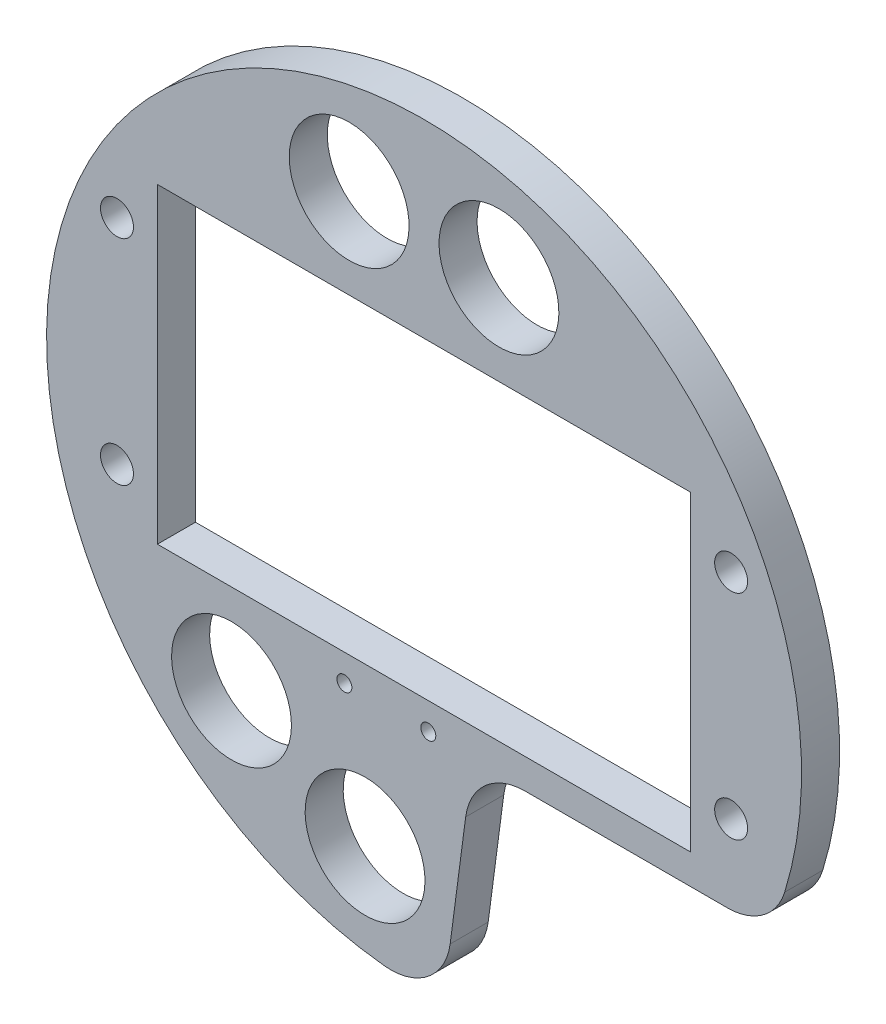
from build123d import *

# Parameters (mm, degrees)
SKETCH2_R           = 10
SKETCH2_R_2         = 2.75
SKETCH2_R_3         = 1.25
SKETCH2_W           = 89
SKETCH2_H           = 52
BOSS_EXTRUDE1_DEPTH = 6.35


with BuildPart() as part:
    # Sketch2 → Boss-Extrude1 (new body)
    with BuildSketch(Plane(origin=(0, 0, -110.625), x_dir=(-1, 0, 0), z_dir=(0, 0, -1))):
        with BuildLine():
            Line((-4.357448371, -54.013133709), (-6.946028661, -34.350914325))
            ThreePointArc((-6.946028661, -34.350914325), (-10.267019124, -28.137778173), (-16.860477275, -25.656176248))
            Line((-16.860477275, -25.656176248), (-50.634811595, -25.656176248))
            ThreePointArc((-50.634811595, -25.656176248), (-56.570299984, -23.704155969), (-60.188549632, -18.610171766))
            ThreePointArc((-60.188549632, -18.610171766), (34.680301225, 52.595405759), (6.605490855, -62.652753256))
            ThreePointArc((6.605490855, -62.652753256), (-0.632673359, -60.562038878), (-4.357448371, -54.013133709))
        make_face()
        with Locations((12.5, 46.343823752)):
            Circle(SKETCH2_R, mode=Mode.SUBTRACT)
        with Locations((-12.5, 46.343823752)):
            Circle(SKETCH2_R, mode=Mode.SUBTRACT)
        with Locations((32.134671235, -35.656176248)):
            Circle(SKETCH2_R, mode=Mode.SUBTRACT)
        with Locations((9.845967479, -46.979324435)):
            Circle(SKETCH2_R, mode=Mode.SUBTRACT)
        with Locations((51.25, 23.184046239)):
            Circle(SKETCH2_R_2, mode=Mode.SUBTRACT)
        with Locations((51.25, -12.496398734)):
            Circle(SKETCH2_R_2, mode=Mode.SUBTRACT)
        with Locations((-51.25, -12.496398734)):
            Circle(SKETCH2_R_2, mode=Mode.SUBTRACT)
        with Locations((-51.25, 23.184046239)):
            Circle(SKETCH2_R_2, mode=Mode.SUBTRACT)
        with Locations((13.291416771, -25.156176248)):
            Circle(SKETCH2_R_3, mode=Mode.SUBTRACT)
        with Locations((-0.708583229, -25.156176248)):
            Circle(SKETCH2_R_3, mode=Mode.SUBTRACT)
        with Locations((0, 5.343823752)):
            Rectangle(SKETCH2_W, SKETCH2_H, mode=Mode.SUBTRACT)
    extrude(amount=-BOSS_EXTRUDE1_DEPTH)


solid = part.part
